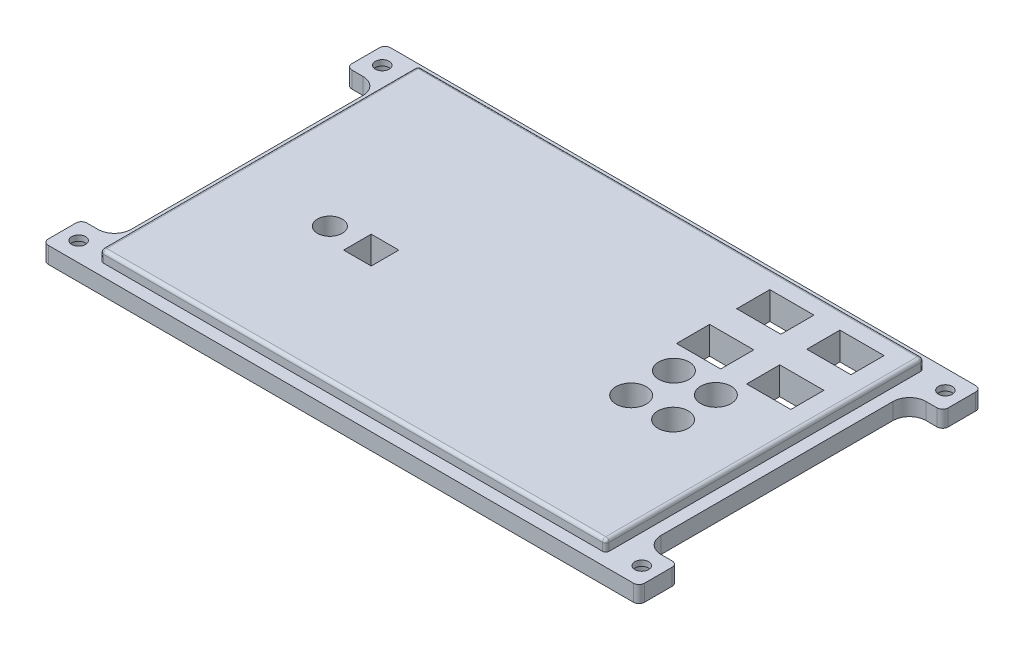
from build123d import *

# Parameters (mm, degrees)
SKETCH_1_W          = 96
SKETCH_1_H          = 62
EXTRUDE_1_DEPTH     = 5
SKETCH_2_W          = 96
SKETCH_2_H          = 62
SKETCH_2_W_2        = 91.6
SKETCH_2_H_2        = 57.6
CUT_EXTRUDE_1_DEPTH = 2
EXTRUDE_2_DEPTH     = 3
FILLET_1_R          = 3
FILLET_2_R          = 1
FILLET_3_R          = 0.6
FILLET_4_R          = 0.6
SKETCH_5_R          = 2.25
CUT_EXTRUDE_2_DEPTH = 2
SKETCH_6_R          = 2.25
SKETCH_6_W          = 5
SKETCH_6_H          = 5
SKETCH_6_R_2        = 2.75
SKETCH_6_W_2        = 8
SKETCH_6_H_2        = 6
CUT_EXTRUDE_3_DEPTH = 63.465990747


with BuildPart() as part:
    # Эскиз1 → Бобышка-Вытянуть1 (new body)
    with BuildSketch(Plane(origin=(0, 0, 0), x_dir=(1, 0, 0), z_dir=(0, 1, 0))):
        Rectangle(SKETCH_1_W, SKETCH_1_H)
    extrude(amount=EXTRUDE_1_DEPTH)

    # Эскиз2 → Вырез-Вытянуть1 (cut)
    with BuildSketch(Plane(origin=(0, 5, 0), x_dir=(1, 0, 0), z_dir=(0, 1, 0))):
        Rectangle(SKETCH_2_W, SKETCH_2_H)
        Rectangle(SKETCH_2_W_2, SKETCH_2_H_2, mode=Mode.SUBTRACT)
    extrude(amount=-CUT_EXTRUDE_1_DEPTH, mode=Mode.SUBTRACT)

    # Эскиз4 → Бобышка-Вытянуть2 (add)
    with BuildSketch(Plane.XZ):
        with BuildLine():
            Line((-54, 31), (-54, 24))
            Line((-54, 24), (-51, 24))
            Line((-51, 24), (-51, 26.25))
            ThreePointArc((-51, 26.25), (-51.883883476, 28.383883476), (-49.75, 27.5))
            Line((-49.75, 27.5), (-48, 27.5))
            Line((-48, 27.5), (-48, 31))
            Line((-48, 31), (-54, 31))
        make_face()
        with BuildLine():
            Line((-51, 26.25), (-51, 24))
            Line((-51, 24), (-48, 24))
            Line((-48, 24), (-48, 27.5))
            Line((-48, 27.5), (-49.75, 27.5))
            ThreePointArc((-49.75, 27.5), (-50.116116524, 26.616116524), (-51, 26.25))
        make_face()
        with BuildLine():
            Line((-54, -24), (-54, -31))
            Line((-54, -31), (-48, -31))
            Line((-48, -31), (-48, -27.5))
            Line((-48, -27.5), (-49.75, -27.5))
            ThreePointArc((-49.75, -27.5), (-51.883883476, -28.383883476), (-51, -26.25))
            Line((-51, -26.25), (-51, -24))
            Line((-51, -24), (-54, -24))
        make_face()
        with BuildLine():
            Line((-49.75, -27.5), (-48, -27.5))
            Line((-48, -27.5), (-48, -24))
            Line((-48, -24), (-51, -24))
            Line((-51, -24), (-51, -26.25))
            ThreePointArc((-51, -26.25), (-50.116116524, -26.616116524), (-49.75, -27.5))
        make_face()
        with BuildLine():
            Line((48, -27.5), (48, -31))
            Line((48, -31), (54, -31))
            Line((54, -31), (54, -24))
            Line((54, -24), (51, -24))
            Line((51, -24), (51, -26.25))
            ThreePointArc((51, -26.25), (51.883883476, -26.616116524), (52.25, -27.5))
            ThreePointArc((52.25, -27.5), (51, -28.75), (49.75, -27.5))
            Line((49.75, -27.5), (48, -27.5))
        make_face()
        with BuildLine():
            Line((48, -24), (48, -27.5))
            Line((48, -27.5), (49.75, -27.5))
            ThreePointArc((49.75, -27.5), (50.116116524, -26.616116524), (51, -26.25))
            Line((51, -26.25), (51, -24))
            Line((51, -24), (48, -24))
        make_face()
        with BuildLine():
            Line((51, 24), (54, 24))
            Line((54, 24), (54, 31))
            Line((54, 31), (48, 31))
            Line((48, 31), (48, 27.5))
            Line((48, 27.5), (49.75, 27.5))
            ThreePointArc((49.75, 27.5), (51, 28.75), (52.25, 27.5))
            ThreePointArc((52.25, 27.5), (51.883883476, 26.616116524), (51, 26.25))
            Line((51, 26.25), (51, 24))
        make_face()
        with BuildLine():
            Line((48, 27.5), (48, 24))
            Line((48, 24), (51, 24))
            Line((51, 24), (51, 26.25))
            ThreePointArc((51, 26.25), (50.116116524, 26.616116524), (49.75, 27.5))
            Line((49.75, 27.5), (48, 27.5))
        make_face()
    extrude(amount=-EXTRUDE_2_DEPTH)

    # Скругление1
    fillet_1_edges = [part.edges().sort_by_distance(p)[0] for p in [
        (-48, 1.5, 24),
        (-48, 1.5, -24),
        (48, 1.5, -24),
        (48, 1.5, 24),
    ]]
    fillet(fillet_1_edges, radius=FILLET_1_R)

    # Скругление2
    fillet_2_edges = [part.edges().sort_by_distance(p)[0] for p in [
        (-54, 1.5, 24),
        (-54, 1.5, 31),
        (-54, 1.5, -31),
        (-54, 1.5, -24),
        (54, 1.5, -24),
        (54, 1.5, -31),
        (54, 1.5, 31),
        (54, 1.5, 24),
    ]]
    fillet(fillet_2_edges, radius=FILLET_2_R)

    # Скругление3
    fillet_3_edges = [part.edges().sort_by_distance(p)[0] for p in [
        (45.8, 5, 0),
        (0, 5, 28.8),
        (-45.8, 5, 0),
        (0, 5, -28.8),
    ]]
    fillet(fillet_3_edges, radius=FILLET_3_R)

    # Скругление4
    # the kernel refuses this fillet: 0.6 mm, written as the material it takes off along each edge
    with BuildSketch(Plane(origin=(-45.2, 4.4, -28.2), x_dir=(0, 0, -1), z_dir=(-1, 0, 0))) as fillet_4_piece_1_section:
        Polygon((0, 0), (FILLET_4_R * 1.02, 0), (FILLET_4_R * 1.02, -FILLET_4_R * 1.02), (0, -FILLET_4_R * 1.02), align=None)
    fillet_4_piece_1 = extrude(amount=FILLET_4_R * 1.02, mode=Mode.PRIVATE)
    fillet_4_piece_1 = fillet_4_piece_1 - Plane(origin=(-45.2, 4.4, -28.2), x_dir=(0, -0.7071067811865475, 0.7071067811865475), z_dir=(-1, 0, 0)) * Sphere(FILLET_4_R, mode=Mode.PRIVATE)
    add(fillet_4_piece_1, mode=Mode.SUBTRACT)
    with BuildSketch(Plane(origin=(45.2, 4.4, -28.2), x_dir=(1, 0, 0), z_dir=(0, 0, -1))) as fillet_4_piece_2_section:
        Polygon((0, 0), (FILLET_4_R * 1.02, 0), (FILLET_4_R * 1.02, -FILLET_4_R * 1.02), (0, -FILLET_4_R * 1.02), align=None)
    fillet_4_piece_2 = extrude(amount=FILLET_4_R * 1.02, mode=Mode.PRIVATE)
    fillet_4_piece_2 = fillet_4_piece_2 - Plane(origin=(45.2, 4.4, -28.2), x_dir=(-0.7071067811865475, -0.7071067811865475, 0), z_dir=(0, 0, -1)) * Sphere(FILLET_4_R, mode=Mode.PRIVATE)
    add(fillet_4_piece_2, mode=Mode.SUBTRACT)
    with BuildSketch(Plane(origin=(-45.2, 4.4, 28.2), x_dir=(0, 0, 1), z_dir=(-1, 0, 0))) as fillet_4_piece_3_section:
        Polygon((0, 0), (FILLET_4_R * 1.02, 0), (FILLET_4_R * 1.02, FILLET_4_R * 1.02), (0, FILLET_4_R * 1.02), align=None)
    fillet_4_piece_3 = extrude(amount=FILLET_4_R * 1.02, mode=Mode.PRIVATE)
    fillet_4_piece_3 = fillet_4_piece_3 - Plane(origin=(-45.2, 4.4, 28.2), x_dir=(0, -0.7071067811865475, -0.7071067811865475), z_dir=(-1, 0, 0)) * Sphere(FILLET_4_R, mode=Mode.PRIVATE)
    add(fillet_4_piece_3, mode=Mode.SUBTRACT)
    with BuildSketch(Plane(origin=(45.2, 4.4, 28.2), x_dir=(1, 0, 0), z_dir=(0, 0, 1))) as fillet_4_piece_4_section:
        Polygon((0, 0), (FILLET_4_R * 1.02, 0), (FILLET_4_R * 1.02, FILLET_4_R * 1.02), (0, FILLET_4_R * 1.02), align=None)
    fillet_4_piece_4 = extrude(amount=FILLET_4_R * 1.02, mode=Mode.PRIVATE)
    fillet_4_piece_4 = fillet_4_piece_4 - Plane(origin=(45.2, 4.4, 28.2), x_dir=(-0.7071067811865475, -0.7071067811865475, 0), z_dir=(0, 0, 1)) * Sphere(FILLET_4_R, mode=Mode.PRIVATE)
    add(fillet_4_piece_4, mode=Mode.SUBTRACT)
    with BuildSketch(Plane(origin=(45.8, 4.4, 28.8), x_dir=(-1, 0, 0), z_dir=(0, -1, 0)), Plane(origin=(-45.8, 4.4, 28.8), x_dir=(0, 0, -1), z_dir=(0, -1, 0))) as fillet_4_piece_5:
        with BuildLine():
            CenterArc((FILLET_4_R, FILLET_4_R), FILLET_4_R, 180, 90)
            Line((0, FILLET_4_R), (0, 0))
            Line((0, 0), (FILLET_4_R, 0))
        make_face()
    extrude(amount=1.4, mode=Mode.SUBTRACT)
    with BuildSketch(Plane(origin=(-45.8, 4.4, -28.8), x_dir=(0, 0, 1), z_dir=(0, -1, 0)), Plane(origin=(45.8, 4.4, -28.8), x_dir=(-1, 0, 0), z_dir=(0, -1, 0))) as fillet_4_piece_6:
        with BuildLine():
            CenterArc((FILLET_4_R, -FILLET_4_R), FILLET_4_R, 90, 90)
            Line((0, -FILLET_4_R), (0, 0))
            Line((0, 0), (FILLET_4_R, 0))
        make_face()
    extrude(amount=1.4, mode=Mode.SUBTRACT)

    # Эскиз5 → Вырез-Вытянуть2 (cut)
    with BuildSketch(Plane.XZ):
        with Locations(Location((-51, 27.5, 0), (0, 0, 270))):
            Circle(SKETCH_5_R)
        with Locations(Location((51, 27.5, 0), (0, 0, 270))):
            Circle(SKETCH_5_R)
        with Locations(Location((-51, -27.5, 0), (0, 0, 270))):
            Circle(SKETCH_5_R)
        with Locations(Location((51, -27.5, 0), (0, 0, 270))):
            Circle(SKETCH_5_R)
    extrude(amount=-CUT_EXTRUDE_2_DEPTH, mode=Mode.SUBTRACT)

    # Эскиз6 → Вырез-Вытянуть3 (cut, through all)
    with BuildSketch(Plane.XZ):
        with Locations(Location((-28.5, 4.5, 0), (0, 0, 270))):
            Circle(SKETCH_6_R)
        with Locations((-21, 4.5)):
            Rectangle(SKETCH_6_W, SKETCH_6_H)
        with Locations(Location((25.33, -4, 0), (0, 0, 270))):
            Circle(SKETCH_6_R_2)
        with Locations(Location((32.93, -4, 0), (0, 0, 270))):
            Circle(SKETCH_6_R_2)
        with Locations(Location((32.93, 3.75, 0), (0, 0, 270))):
            Circle(SKETCH_6_R_2)
        with Locations(Location((25.33, 3.75, 0), (0, 0, 270))):
            Circle(SKETCH_6_R_2)
        with Locations((25.3, -11.5)):
            Rectangle(SKETCH_6_W_2, SKETCH_6_H_2)
        with Locations((25.3, -22.4)):
            Rectangle(SKETCH_6_W_2, SKETCH_6_H_2)
        with Locations((38, -22.4)):
            Rectangle(SKETCH_6_W_2, SKETCH_6_H_2)
        with Locations((38, -11.5)):
            Rectangle(SKETCH_6_W_2, SKETCH_6_H_2)
    extrude(amount=-CUT_EXTRUDE_3_DEPTH, mode=Mode.SUBTRACT)


solid = part.part
